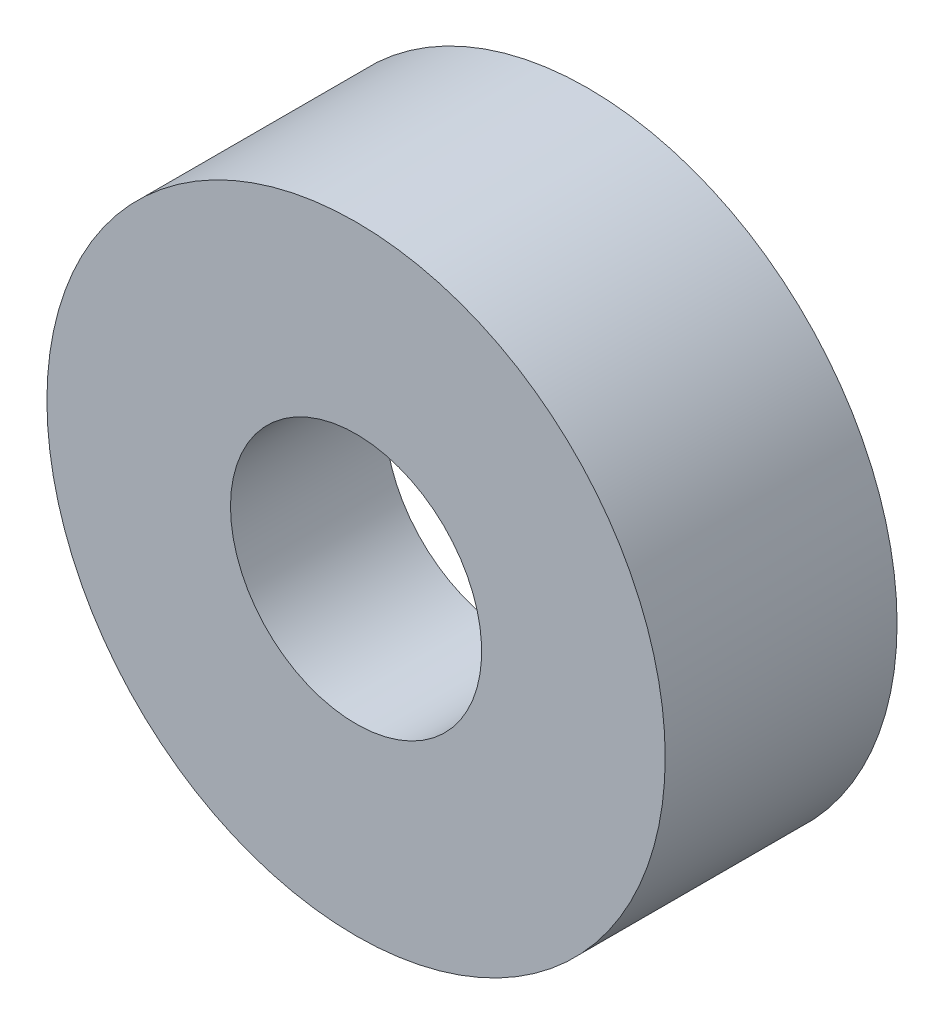
from build123d import *


with BuildPart() as part:
    # Sketch2 → Revolve1 (revolve)
    with BuildSketch(Plane(origin=(0, 0, 0), x_dir=(1, 0, 0), z_dir=(0, 1, 0))):
        with BuildLine():
            Line((0, 0), (4.75, 0))
            Line((4.75, 0), (4.75, 4))
            Line((4.75, 4), (3, 4))
            ThreePointArc((3, 4), (1.313448514, 4.720172772), (0, 6))
            Line((0, 6), (0, 0))
        make_face()
    revolve(axis=Axis((8, 0, -7.218023256), (0, 0, 1)))


solid = part.part
